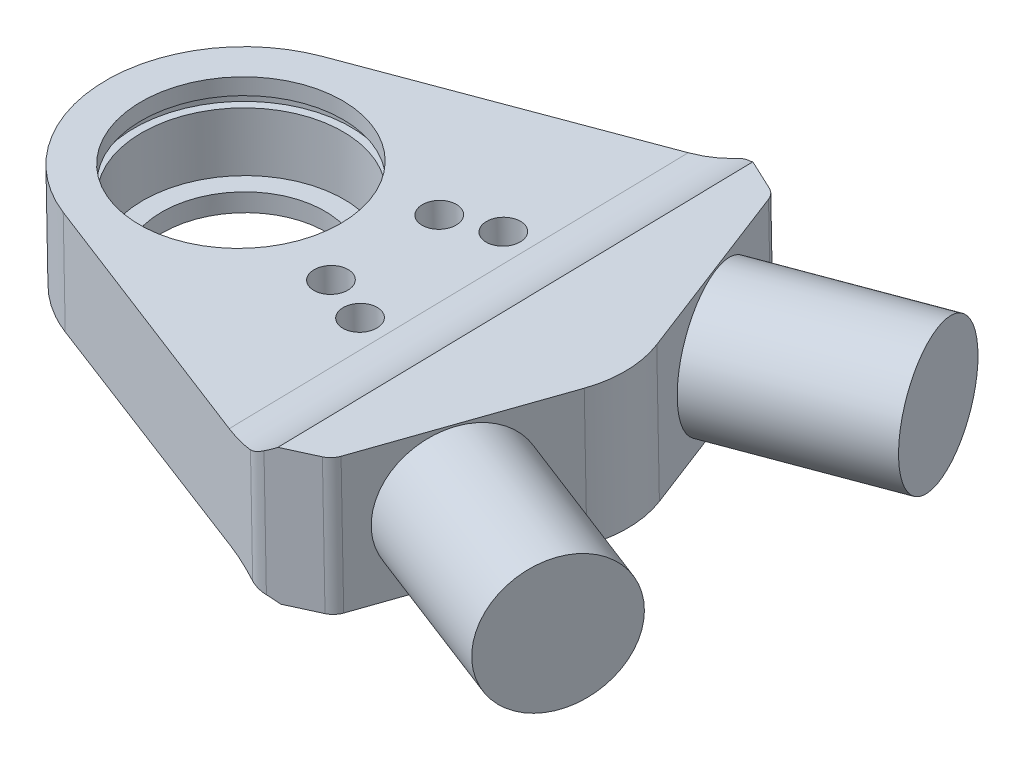
from build123d import *

# Parameters (mm, degrees)
WISHBONE_END_BASE_BODY_DEPTH           = 6.35
WISHBONE_END_BASE_BODY_DEPTH_BACK      = 6.35
WISHBONE_END_BODY_SKETCH_R             = 7.6199999999999655
SPHERICAL_BEARING_BORE_HOLE_DEPTH      = 994.1778562213065
SPHERICAL_BEARING_BORE_HOLE_DEPTH_BACK = 3.2385
SKETCH37_R                             = 9.398000000000074
GROOVE_START                           = 3.2385
SKETCH38_R                             = 10.10920000000004
GROOVE_FOR_99142A390_DEPTH             = 0.9905999999999999
SKETCH39_R                             = 6.172199999999972
LEADING_ARM_TUBE_INSERT_DEPTH          = 15.875
SKETCH40_R                             = 6.172199999999972
TRAILING_ARM_TUBE_INSERT_DEPTH         = 15.875
CUT_EXTRUDE3_DEPTH                     = 614.178901904527
CUT_EXTRUDE3_DEPTH_BACK                = 614.178901904527
FILLET1_R                              = 9.525
CHAMFER1_SIZE                          = 3.8099999999999996
FILLET2_R                              = 9.525
FILLET3_R                              = 1.5875
SKETCH42_R                             = 1.587499999999916
SKETCH42_R_2                           = 1.5874999999997772
SKETCH42_R_3                           = 1.5875000000002346
MACHINING_ALIGNMENT_HOLES_DEPTH        = 993.6874865506448


with BuildPart() as part:
    # wishbone end body sketch → wishbone end base body (new, two sides: drawn at the far end of the back side and taken through both)
    with BuildSketch(Plane(origin=(0.7258862866452951, 134.87955098448836, 3.3083663449025464), x_dir=(0.999985527474362, -0.005378423373816958, -0.00013192359218796315), z_dir=(0.005380041061385716, 0.9996848486991856, 0.024520571760546048)).offset(-WISHBONE_END_BASE_BODY_DEPTH_BACK)):
        with BuildLine():
            Line((-590.7162762655777, -779.9030929511134), (-558.8429156016132, -791.9248886865561))
            Line((-558.8429156016132, -791.9248886865561), (-549.8791042276648, -768.1591552526331))
            Line((-549.8791042276648, -768.1591552526331), (-558.6610183956265, -744.3256078132241))
            Line((-558.6610183956265, -744.3256078132241), (-590.6253276625844, -756.1034525144474))
            ThreePointArc((-590.6253276625844, -756.1034525144474), (-598.9342778486073, -767.9716944579083), (-590.7162762655777, -779.9030929511134))
        make_face()
        with Locations(Location((-586.2343705786035, -768.0202262341521, 0), (0, 0, 270))):
            Circle(WISHBONE_END_BODY_SKETCH_R, mode=Mode.SUBTRACT)
    extrude(amount=WISHBONE_END_BASE_BODY_DEPTH + WISHBONE_END_BASE_BODY_DEPTH_BACK)

    # Sketch37 → spherical bearing bore hole (cut, two sides: drawn at the far end of the back side and taken through both)
    with BuildSketch(Plane(origin=(0.7258862866452951, 134.87955098448836, 3.3083663449025464), x_dir=(0.999985527474362, -0.005378423373816958, -0.00013192359218796315), z_dir=(0.005380041061385716, 0.9996848486991856, 0.024520571760546048)).offset(-SPHERICAL_BEARING_BORE_HOLE_DEPTH_BACK)):
        with Locations(Location((-586.2343705786035, -768.0202262341521, 0), (0, 0, 270))):
            Circle(SKETCH37_R)
    extrude(amount=SPHERICAL_BEARING_BORE_HOLE_DEPTH + SPHERICAL_BEARING_BORE_HOLE_DEPTH_BACK, mode=Mode.SUBTRACT)

    # Sketch38 → groove for 99142A390 (cut)
    with BuildSketch(Plane(origin=(0.7258862866452951, 134.87955098448836, 3.3083663449025464), x_dir=(0.999985527474362, -0.005378423373816958, -0.00013192359218796315), z_dir=(0.005380041061385716, 0.9996848486991856, 0.024520571760546048)).offset(GROOVE_START)):
        with Locations(Location((-586.2343705786035, -768.0202262341521, 0), (0, 0, 270))):
            Circle(SKETCH38_R)
    extrude(amount=-GROOVE_FOR_99142A390_DEPTH, mode=Mode.SUBTRACT)

    # Sketch39 → leading arm tube insert (add)
    with BuildSketch(Plane(origin=(-227.74660652476513, 3.3313146383369725, -85.84541568022186), x_dir=(0.3526386884421761, -0.005158146778901092, -0.9357453440630037), z_dir=(0.9356452552652121, -0.013685950287986396, 0.3526764112673413))):
        with Locations(Location((-928.7082188867262, 110.62389056036547, 0), (0, 0, 0.295569033))):
            Circle(SKETCH39_R)
    extrude(amount=LEADING_ARM_TUBE_INSERT_DEPTH)

    # Sketch40 → trailing arm tube insert (add)
    with BuildSketch(Plane(origin=(-733.3441053167152, -2.681708402002071, 270.23369281713326), x_dir=(-0.3457621685662157, -0.0012643904898342719, -0.938321333075763), z_dir=(0.9383150593615196, 0.003431250568691938, -0.34576448038357405))):
        with Locations(Location((-521.3169196855705, 121.34025761798294, 0), (0, 0, 0.072444684))):
            Circle(SKETCH40_R)
    extrude(amount=TRAILING_ARM_TUBE_INSERT_DEPTH)

    # Sketch41 → Cut-Extrude3 (cut, two sides: drawn at the far end of the back side and taken through both)
    with BuildSketch(Plane(origin=(-2.943409073321915, -18.871393740527775, 770.0180176181074), x_dir=(-0.9999926986368375, 9.362436458525497e-05, -0.003820197310804283), z_dir=(0.0038213443989151604, 0.024500194493421494, -0.9996925216269098)).offset(-CUT_EXTRUDE3_DEPTH_BACK)):
        Polygon((595.2948241213879, 131.77671300237452), (595.2873859667309, 133.15922897461502), (557.1948241213879, 133.159228974615), (557.1948241213879, 131.571728974615), align=None)
        Polygon((595.2350378549631, 142.88907514922224), (557.126497101028, 142.68404517085534), (557.126497101028, 144.27154517085532), (595.226497101028, 144.47652919861486), align=None)
    extrude(amount=CUT_EXTRUDE3_DEPTH + CUT_EXTRUDE3_DEPTH_BACK, mode=Mode.SUBTRACT)

    # Fillet1
    # the kernel refuses this fillet: 9.525 mm, written as the material it adds along each edge
    with BuildSketch(Plane(origin=(-560.2724336268298, 113.41353360474875, 807.3240128802753), x_dir=(-3.2942809255927247e-12, -0.9996998207983545, -0.02450037337955774), z_dir=(0.0038213443989151483, 0.024500194493421494, -0.9996925216269098))) as fillet1_piece_1_section:
        with BuildLine():
            CenterArc((9.525000000017343, 5.265141854675068), FILLET1_R, 179.99999999981125, 33.55730976200755)
            Line((1.734599e-11, 5.265141854706447), (-0.19049999998265063, 5.265141854707075))
            Line((-0.19049999998265063, 5.265141854707075), (-0.1904999999999994, 6.2734e-13))
            Line((-0.1904999999999994, 6.2734e-13), (-6.2619e-13, -0.19050000000003728))
            ThreePointArc((-6.2619e-13, -0.19050000000003728), (0.7937500000033896, -0.19050000000265227), (1.4287500000078057, -0.10530283709351278))
            Line((1.4287500000078057, -0.10530283709351278), (1.5875000000079915, 0))
        make_face()
    fillet1_piece_1 = extrude(amount=72.36652834652159, mode=Mode.PRIVATE)
    fillet1_piece_1 = split(fillet1_piece_1, bisect_by=Plane(origin=(-569.064048669562, 113.51391058502266, 790.8244812436348), z_dir=(0.35290085216371403, 0.021045143050144578, -0.9354240164204272)), keep=Keep.TOP, mode=Mode.PRIVATE)
    fillet1_piece_1 = split(fillet1_piece_1, bisect_by=Plane(origin=(-568.9133352872509, 114.4801954294582, 751.396723516925), z_dir=(0.34573964848360106, -0.024868248849107495, 0.9380008878810375)), keep=Keep.TOP, mode=Mode.PRIVATE)
    add(fillet1_piece_1)
    with BuildSketch(Plane(origin=(-559.9274640787987, 124.70915530829745, 735.1857328131279), x_dir=(-0.9999782260055279, 0.005472088364658121, -0.0036883280448706773), z_dir=(-0.0038213443989151483, -0.024500194493421494, 0.9996925216269098))) as fillet1_piece_2_section:
        with BuildLine():
            CenterArc((5.273648095245833, -9.525000000000006), FILLET1_R, 89.99999999999999, 33.55705973982701)
            Line((0.00854087754486855, -1.5874770245300465), (-0.09676126680913032, -1.4287265650206478))
            ThreePointArc((-0.09676126680913032, -1.4287265650206478), (-0.18622680417126483, -0.794763417570426), (-0.19049724294364254, -0.0010249053053967))
            Line((-0.19049724294364254, -0.0010249053053967), (-2.955e-14, 0.19049999999999728))
            Line((-2.955e-14, 0.19049999999999728), (5.2736480952458065, 0.1904999999999973))
            Line((5.2736480952458065, 0.1904999999999973), (5.273648095245836, 0))
        make_face()
    fillet1_piece_2 = extrude(amount=72.42179621801027, mode=Mode.PRIVATE)
    fillet1_piece_2 = split(fillet1_piece_2, bisect_by=Plane(origin=(-569.0001389759076, 123.73065535763696, 791.0784480398987), z_dir=(0.35290085216371403, 0.021045143050144578, -0.9354240164204272)), keep=Keep.TOP, mode=Mode.PRIVATE)
    fillet1_piece_2 = split(fillet1_piece_2, bisect_by=Plane(origin=(-568.8494001928565, 124.697103483473, 751.6440278829348), z_dir=(0.34573964848360106, -0.024868248849107495, 0.9380008878810375)), keep=Keep.TOP, mode=Mode.PRIVATE)
    add(fillet1_piece_2)

    # Chamfer1
    chamfer1_edges = [part.edges().sort_by_distance(p)[0] for p in [
        (-558.1089414465442, 118.46651268395277, 795.0688611446163),
        (-557.9270468730695, 119.63271283819378, 747.4838685753589),
    ]]
    chamfer(chamfer1_edges, length=CHAMFER1_SIZE)

    # Fillet2
    fillet2_edges = [part.edges().sort_by_distance(p)[0] for p in [
        (-549.1452598015858, 119.00105931742645, 771.3090911275373),
    ]]
    fillet(fillet2_edges, radius=FILLET2_R)

    # Fillet3
    fillet3_edges = [part.edges().sort_by_distance(p)[0] for p in [
        (-561.5020537397296, 119.61471747963421, 748.801110510107),
        (-561.6737763595983, 118.51373386067205, 793.7250432821822),
        (-556.764389199803, 118.54669467897371, 791.5048956420608),
        (-556.6097788123484, 119.53796481007879, 751.0576519581815),
    ]]
    fillet(fillet3_edges, radius=FILLET3_R)

    # Sketch42 → machining alignment holes (cut, through all)
    with BuildSketch(Plane(origin=(0.7515088558077796, 139.6405730446522, 3.42514613128373), x_dir=(0.9999855274743621, -0.005378423373807206, -0.0001319235921877165), z_dir=(0.005380041061375963, 0.9996848486991857, 0.024520571760544684))):
        with Locations(Location((-568.57694591022, -761.514019457373, 0), (0, 0, 270))):
            Circle(SKETCH42_R)
        with Locations(Location((-568.6271868865741, -774.6611941588587, 0), (0, 0, 270))):
            Circle(SKETCH42_R)
        with Locations(Location((-572.9243944265849, -773.0404001728256, 0), (0, 0, 270))):
            Circle(SKETCH42_R_2)
        with Locations(Location((-572.8864152580355, -763.1019236507452, 0), (0, 0, 270))):
            Circle(SKETCH42_R_3)
    extrude(amount=-MACHINING_ALIGNMENT_HOLES_DEPTH, mode=Mode.SUBTRACT)


solid = part.part
